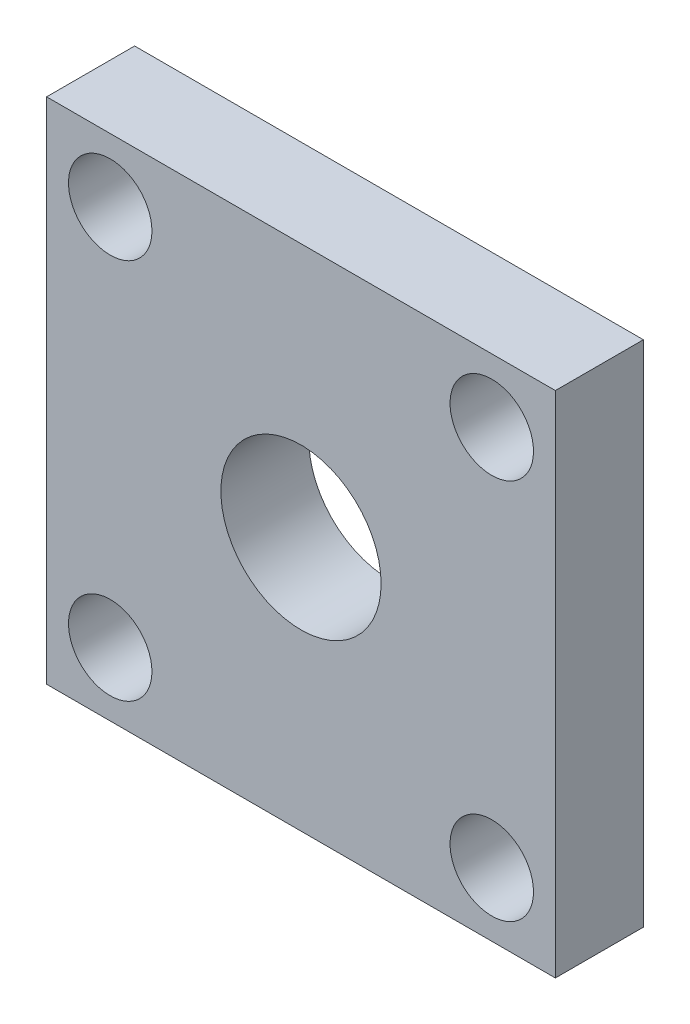
from build123d import *

# Parameters (mm, degrees)
SKETCH1_W           = 25.4
SKETCH1_H           = 25.4
SKETCH1_R           = 2.0828
SKETCH1_R_2         = 4
BOSS_EXTRUDE1_DEPTH = 4.3942


with BuildPart() as part:
    # Sketch1 → Boss-Extrude1 (new body)
    with BuildSketch(Plane.XY):
        with Locations((12.7, 12.7)):
            Rectangle(SKETCH1_W, SKETCH1_H)
        with Locations((3.175, 3.175)):
            Circle(SKETCH1_R, mode=Mode.SUBTRACT)
        with Locations((3.175, 22.225)):
            Circle(SKETCH1_R, mode=Mode.SUBTRACT)
        with Locations((22.225, 22.225)):
            Circle(SKETCH1_R, mode=Mode.SUBTRACT)
        with Locations((22.225, 3.175)):
            Circle(SKETCH1_R, mode=Mode.SUBTRACT)
        with Locations((12.7, 12.7)):
            Circle(SKETCH1_R_2, mode=Mode.SUBTRACT)
    extrude(amount=BOSS_EXTRUDE1_DEPTH)


solid = part.part
